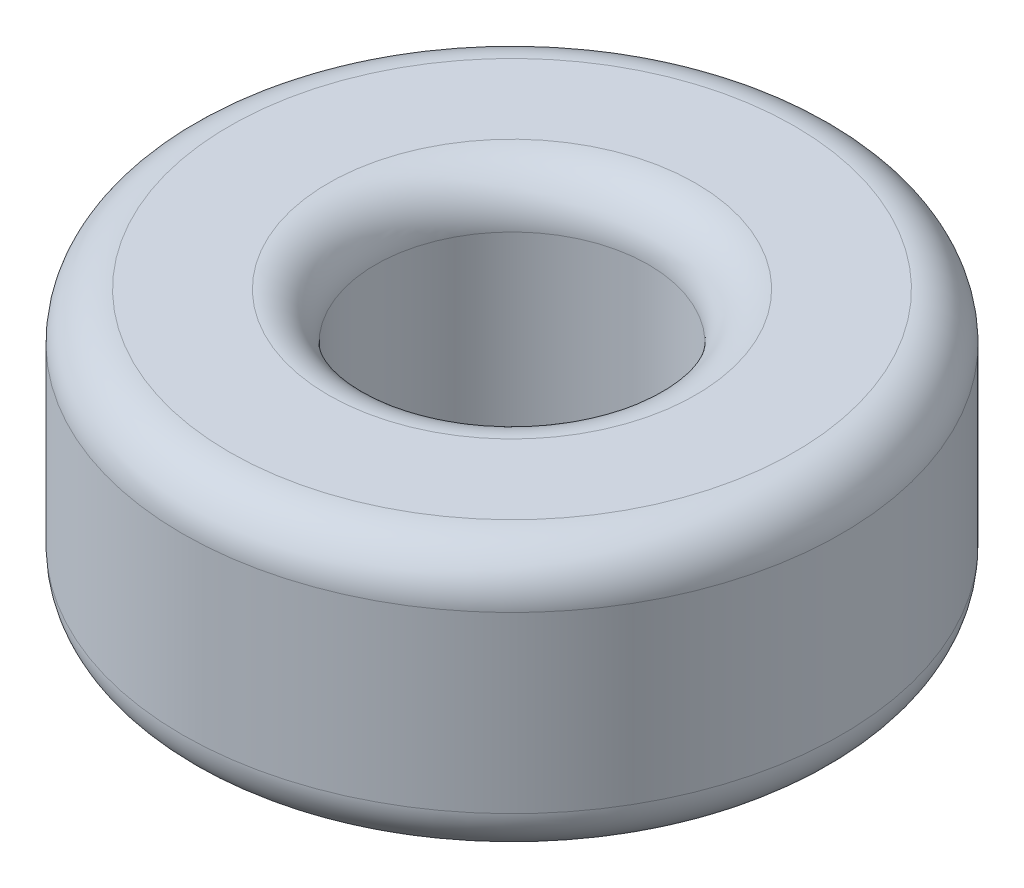
from build123d import *

# Parameters (mm, degrees)
SKETCH1_R           = 70
SKETCH1_R_2         = 29
BOSS_EXTRUDE1_DEPTH = 57
FILLET1_R           = 10
FILLET2_R           = 10
FILLET3_R           = 10
FILLET4_R           = 10


with BuildPart() as part:
    # Sketch1 → Boss-Extrude1 (new body)
    with BuildSketch(Plane(origin=(0, 0, 0), x_dir=(1, 0, 0), z_dir=(0, 1, 0))):
        Circle(SKETCH1_R)
        Circle(SKETCH1_R_2, mode=Mode.SUBTRACT)
    extrude(amount=BOSS_EXTRUDE1_DEPTH)

    # Fillet1
    fillet1_edges = [part.edges().sort_by_distance(p)[0] for p in [
        (-70, 57, 0),
    ]]
    fillet(fillet1_edges, radius=FILLET1_R)

    # Fillet2
    fillet2_edges = [part.edges().sort_by_distance(p)[0] for p in [
        (-70, 0, 0),
    ]]
    fillet(fillet2_edges, radius=FILLET2_R)

    # Fillet3
    fillet3_edges = [part.edges().sort_by_distance(p)[0] for p in [
        (-29, 57, 0),
    ]]
    fillet(fillet3_edges, radius=FILLET3_R)

    # Fillet4
    fillet4_edges = [part.edges().sort_by_distance(p)[0] for p in [
        (-29, 0, 0),
    ]]
    fillet(fillet4_edges, radius=FILLET4_R)


solid = part.part
